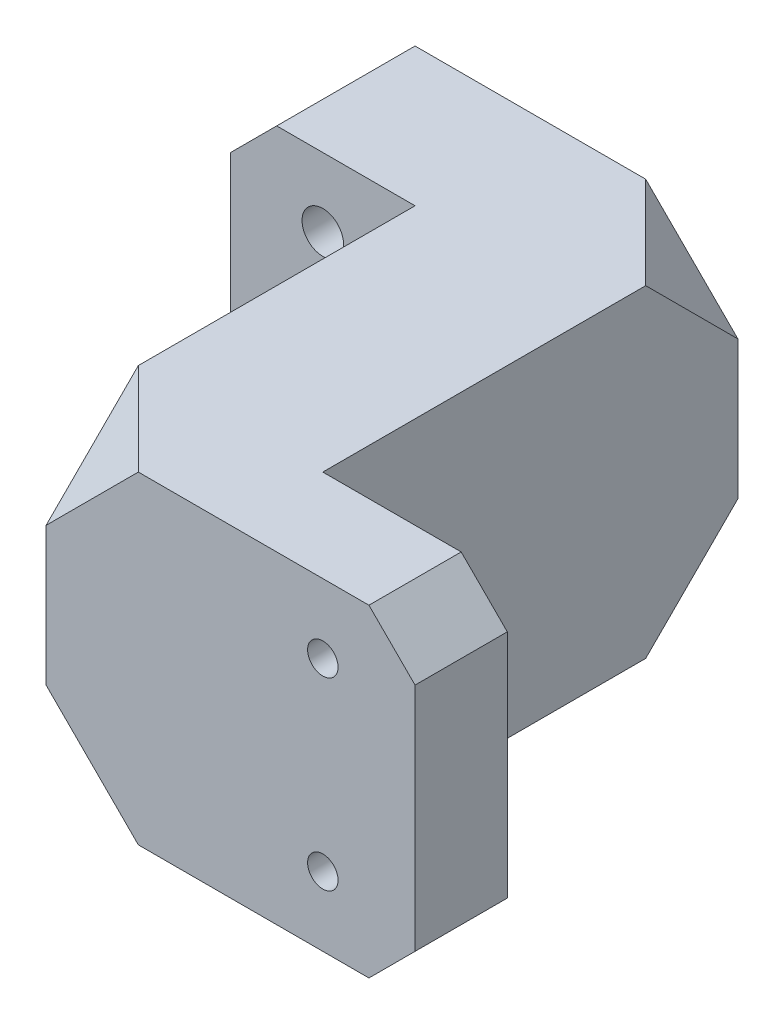
from build123d import *

# Parameters (mm, degrees)
SKETCH1_W                                            = 60
SKETCH1_H                                            = 55
BOSS_EXTRUDE1_DEPTH                                  = 17.5
SKETCH2_W                                            = 20
SKETCH2_H                                            = 45
SKETCH2_H_2                                          = 40
CUT_EXTRUDE1_DEPTH                                   = 54.677276384
M4_TAPPED_HOLE1_D                                    = 3.3
CBORE_FOR_M4_HEXAGON_SOCKET_HEAD_CAP_SCR_D           = 4.5
CBORE_FOR_M4_HEXAGON_SOCKET_HEAD_CAP_SCR_CBORE_D     = 8
CBORE_FOR_M4_HEXAGON_SOCKET_HEAD_CAP_SCR_CBORE_DEPTH = 4.6
CHAMFER1_SIZE                                        = 5
CHAMFER2_START                                       = 25.980762114
CHAMFER2_OUTLINE_W                                   = 15
CHAMFER2_OUTLINE_H                                   = 17
CHAMFER2_DEPTH                                       = 7.019237886
CHAMFER3_START                                       = -33
CHAMFER3_OUTLINE_W                                   = 15
CHAMFER3_OUTLINE_H                                   = 17
CHAMFER3_DEPTH                                       = 7.019237886


with BuildPart() as part:
    # Sketch1 → Boss-Extrude1 (new, symmetric)
    with BuildSketch(Plane(origin=(0, 0, 0), x_dir=(1, 0, 0), z_dir=(0, 1, 0))):
        Rectangle(SKETCH1_W, SKETCH1_H)
    extrude(amount=BOSS_EXTRUDE1_DEPTH, both=True)

    # Sketch2 → Cut-Extrude1 (cut, through all)
    with BuildSketch(Plane(origin=(0, 17.5, 0), x_dir=(1, 0, 0), z_dir=(0, 1, 0))):
        with Locations((20, 5)):
            Rectangle(SKETCH2_W, SKETCH2_H)
        with Locations((-20, -7.5)):
            Rectangle(SKETCH2_W, SKETCH2_H_2)
    extrude(amount=-CUT_EXTRUDE1_DEPTH, mode=Mode.SUBTRACT)

    # M4 Tapped Hole1 (through all)
    with Locations(Plane(origin=(0, 0, 17.5), x_dir=(-1, 0, 0), z_dir=(0, 0, -1))):
        with Locations((-20, 10), (-20, -10)):
            Hole(M4_TAPPED_HOLE1_D / 2)

    # CBORE for M4 Hexagon socket head cap screws1 (through all)
    with Locations(Plane(origin=(0, 0, -27.5), x_dir=(-1, 0, 0), z_dir=(0, 0, -1))):
        with Locations((20, 10), (20, -10)):
            CounterBoreHole(CBORE_FOR_M4_HEXAGON_SOCKET_HEAD_CAP_SCR_D / 2, CBORE_FOR_M4_HEXAGON_SOCKET_HEAD_CAP_SCR_CBORE_D / 2, CBORE_FOR_M4_HEXAGON_SOCKET_HEAD_CAP_SCR_CBORE_DEPTH)

    # Chamfer1
    chamfer1_edges = [part.edges().sort_by_distance(p)[0] for p in [
        (30, 17.5, 22.5),
        (-30, 17.5, -20),
        (30, -17.5, 22.5),
        (-30, -17.5, -20),
    ]]
    chamfer(chamfer1_edges, length=CHAMFER1_SIZE)

    # Chamfer2: read off the stored shape, not the designer's step
    # Chamfer2 outline → Chamfer2 (cut)
    with BuildSketch(Plane(origin=(0, 0, 0), x_dir=(0.8164965809277258, 0.40824829046386313, 0.40824829046386313), z_dir=(0.5773502691896258, -0.5773502691896258, -0.5773502691896258)).offset(CHAMFER2_START)):
        with Locations((-12.5, -7.5)):
            Rectangle(CHAMFER2_OUTLINE_W, CHAMFER2_OUTLINE_H)
    chamfer2 = extrude(amount=CHAMFER2_DEPTH, mode=Mode.SUBTRACT)

    # Chamfer3: read off the stored shape, not the designer's step
    # Chamfer3 outline → Chamfer3 (cut)
    with BuildSketch(Plane(origin=(0, 0, 0), x_dir=(0.8164965809277258, -0.40824829046386313, 0.40824829046386313), z_dir=(0.5773502691896258, 0.5773502691896258, -0.5773502691896258)).offset(CHAMFER3_START)):
        with Locations((12.5, -7.5)):
            Rectangle(CHAMFER3_OUTLINE_W, CHAMFER3_OUTLINE_H)
    chamfer3 = extrude(amount=CHAMFER3_DEPTH, mode=Mode.SUBTRACT)

    # Mirror1: Chamfer2, Chamfer3 across plane
    add(chamfer2.mirror(Plane.ZX), mode=Mode.SUBTRACT)
    add(chamfer3.mirror(Plane.ZX), mode=Mode.SUBTRACT)


solid = part.part
